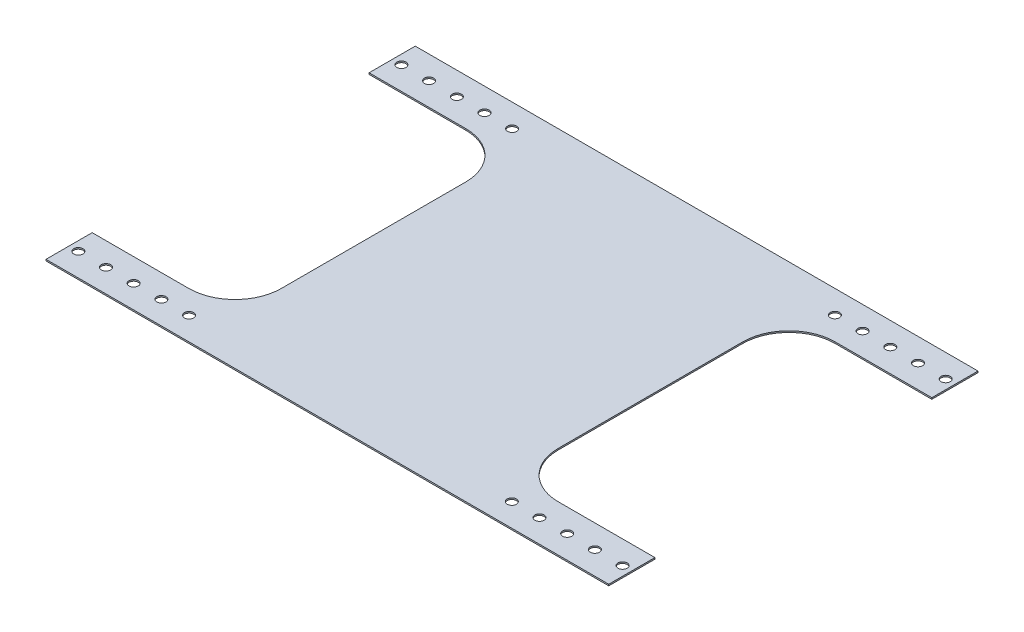
from build123d import *

# Parameters (mm, degrees)
SHEET_DEPTH             = 0.79375
SKETCH4_R               = 2.5
MOUNTHOLES_DEPTH        = 183.281074276
MIRROR4_COPY_1_SKETCH_R = 2.5
MIRROR4_COPY_1_DEPTH    = 183.281074276
MIRROR4_COPY_2_SKETCH_R = 2.5
MIRROR4_COPY_2_DEPTH    = 183.281074276


with BuildPart() as part:
    # Sketch3 → Sheet (new body)
    with BuildSketch(Plane(origin=(0, 0, 0), x_dir=(1, 0, 0), z_dir=(0, 1, 0))):
        with BuildLine():
            Line((-152.4, 100), (152.4, 100))
            Line((152.4, 100), (152.4, 75))
            Line((152.4, 75), (100, 75))
            ThreePointArc((100, 75), (82.32233047, 67.67766953), (75, 50))
            Line((75, 50), (75, -50))
            ThreePointArc((75, -50), (82.32233047, -67.67766953), (100, -75))
            Line((100, -75), (152.4, -75))
            Line((152.4, -75), (152.4, -100))
            Line((152.4, -100), (-152.4, -100))
            Line((-152.4, -100), (-152.4, -75))
            Line((-152.4, -75), (-100, -75))
            ThreePointArc((-100, -75), (-82.32233047, -67.67766953), (-75, -50))
            Line((-75, -50), (-75, 50))
            ThreePointArc((-75, 50), (-82.32233047, 67.67766953), (-100, 75))
            Line((-100, 75), (-152.4, 75))
            Line((-152.4, 75), (-152.4, 100))
        make_face()
    extrude(amount=SHEET_DEPTH)

    # Sketch4 → MountHoles (cut, through all)
    with BuildSketch(Plane(origin=(0, 0.79375, 0), x_dir=(1, 0, 0), z_dir=(0, 1, 0))):
        with Locations((-147.4, 87.5)):
            Circle(SKETCH4_R)
        with Locations((-132.4, 87.5)):
            Circle(SKETCH4_R)
        with Locations((-117.4, 87.5)):
            Circle(SKETCH4_R)
        with Locations((-102.4, 87.5)):
            Circle(SKETCH4_R)
        with Locations((-87.4, 87.5)):
            Circle(SKETCH4_R)
    mountholes = extrude(amount=-MOUNTHOLES_DEPTH, mode=Mode.SUBTRACT)

    # Mirror3: MountHoles across plane
    add(mountholes.mirror(Plane.XY), mode=Mode.SUBTRACT)

    # Mirror4 copy 1 sketch → Mirror4 copy 1 (cut, through all)
    with BuildSketch(Plane(origin=(0, 0.79375, 0), x_dir=(-1, 0, 0), z_dir=(0, 1, 0))):
        with Locations((-147.4, 87.5)):
            Circle(MIRROR4_COPY_1_SKETCH_R)
        with Locations((-132.4, 87.5)):
            Circle(MIRROR4_COPY_1_SKETCH_R)
        with Locations((-117.4, 87.5)):
            Circle(MIRROR4_COPY_1_SKETCH_R)
        with Locations((-102.4, 87.5)):
            Circle(MIRROR4_COPY_1_SKETCH_R)
        with Locations((-87.4, 87.5)):
            Circle(MIRROR4_COPY_1_SKETCH_R)
    extrude(amount=-MIRROR4_COPY_1_DEPTH, mode=Mode.SUBTRACT)

    # Mirror4 copy 2 sketch → Mirror4 copy 2 (cut, through all)
    with BuildSketch(Plane(origin=(0, 0.79375, 0), x_dir=(-1, 0, 0), z_dir=(0, 1, 0))):
        with Locations((-147.4, -87.5)):
            Circle(MIRROR4_COPY_2_SKETCH_R)
        with Locations((-132.4, -87.5)):
            Circle(MIRROR4_COPY_2_SKETCH_R)
        with Locations((-117.4, -87.5)):
            Circle(MIRROR4_COPY_2_SKETCH_R)
        with Locations((-102.4, -87.5)):
            Circle(MIRROR4_COPY_2_SKETCH_R)
        with Locations((-87.4, -87.5)):
            Circle(MIRROR4_COPY_2_SKETCH_R)
    extrude(amount=-MIRROR4_COPY_2_DEPTH, mode=Mode.SUBTRACT)


solid = part.part
